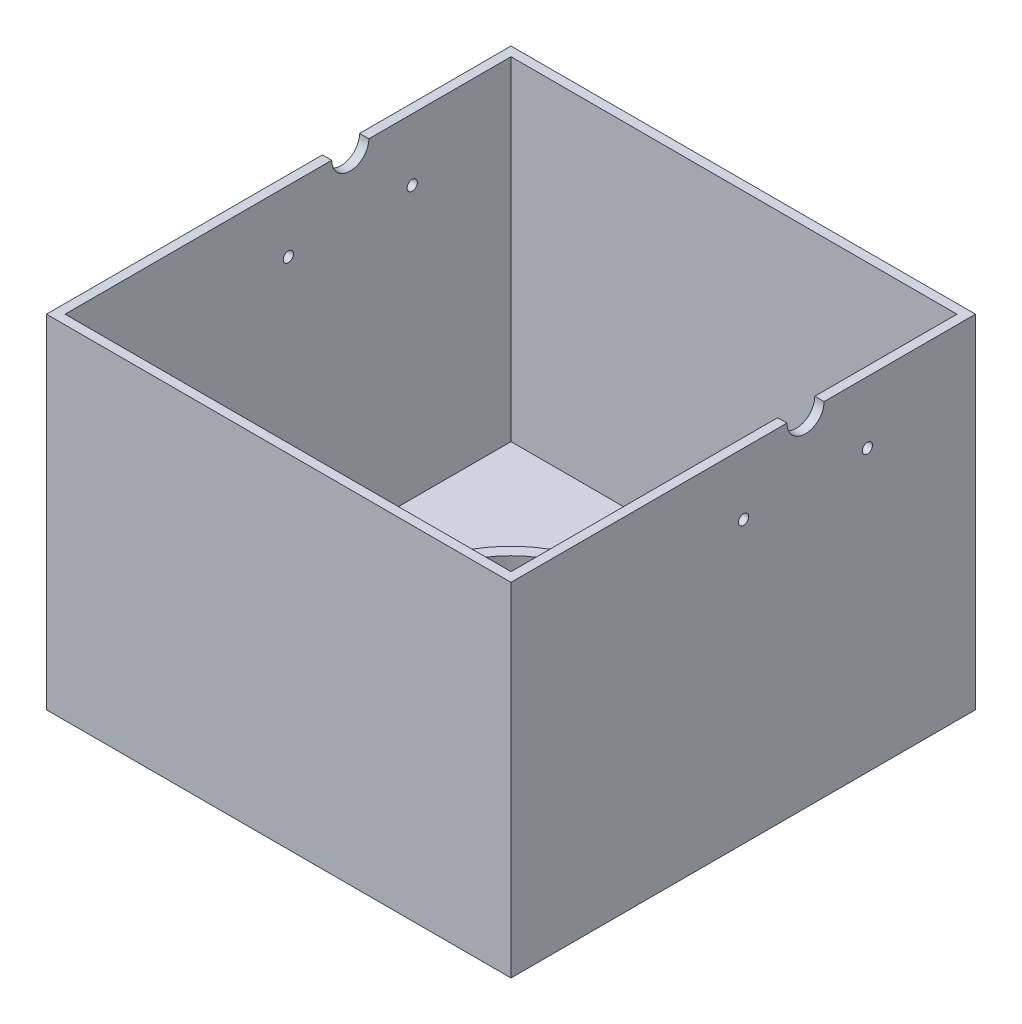
from build123d import *

# Parameters (mm, degrees)
SKETCH_1_W          = 150
SKETCH_1_H          = 150
EXTRUDE_1_DEPTH     = 3
SKETCH_2_W          = 150
SKETCH_2_H          = 150
SKETCH_2_W_2        = 144
SKETCH_2_H_2        = 144
EXTRUDE_2_DEPTH     = 107.65
SKETCH_3_R          = 31.25
CUT_EXTRUDE_1_DEPTH = 91
SKETCH_4_R          = 6
CUT_EXTRUDE_2_DEPTH = 201.9189451
SKETCH_8_R          = 35
SKETCH_8_R_2        = 31.25
EXTRUDE_4_DEPTH     = 18
SKETCH_9_R          = 1.65
CUT_EXTRUDE_3_DEPTH = 201.9189451
SKETCH_11_R         = 31.25
SKETCH_11_R_2       = 27.5
EXTRUDE_5_DEPTH     = 3


with BuildPart() as part:
    # 草图1 → 凸台-拉伸1 (new body)
    with BuildSketch(Plane(origin=(0, 0, 0), x_dir=(1, 0, 0), z_dir=(0, 1, 0))):
        Rectangle(SKETCH_1_W, SKETCH_1_H)
    extrude(amount=EXTRUDE_1_DEPTH)

    # 草图2 → 凸台-拉伸2 (add)
    with BuildSketch(Plane(origin=(0, 3, 0), x_dir=(1, 0, 0), z_dir=(0, 1, 0))):
        Rectangle(SKETCH_2_W, SKETCH_2_H)
        Rectangle(SKETCH_2_W_2, SKETCH_2_H_2, mode=Mode.SUBTRACT)
    extrude(amount=EXTRUDE_2_DEPTH)

    # 草图3 → 切除-拉伸1 (cut)
    with BuildSketch(Plane.XZ):
        Circle(SKETCH_3_R)
    extrude(amount=-CUT_EXTRUDE_1_DEPTH, mode=Mode.SUBTRACT)

    # 草图4 → 切除-拉伸2 (cut, through all)
    with BuildSketch(Plane.ZY.offset(75)):
        with Locations((-20.1, 110.65)):
            Circle(SKETCH_4_R)
    extrude(amount=-CUT_EXTRUDE_2_DEPTH, mode=Mode.SUBTRACT)

    # 草图8 → 凸台-拉伸4 (add, symmetric)
    with BuildSketch(Plane(origin=(0, 3, 0), x_dir=(1, 0, 0), z_dir=(0, 1, 0))):
        Circle(SKETCH_8_R)
        Circle(SKETCH_8_R_2, mode=Mode.SUBTRACT)
    extrude(amount=EXTRUDE_4_DEPTH, both=True)

    # 草图9 → 切除-拉伸3 (cut, through all)
    with BuildSketch(Plane.ZY.offset(75)):
        with Locations((-40.1, 90.65)):
            Circle(SKETCH_9_R)
        with Locations((-0.1, 90.65)):
            Circle(SKETCH_9_R)
    extrude(amount=-CUT_EXTRUDE_3_DEPTH, mode=Mode.SUBTRACT)

    # 草图11 → 凸台-拉伸5 (add)
    with BuildSketch(Plane.XZ.offset(15)):
        Circle(SKETCH_11_R)
        Circle(SKETCH_11_R_2, mode=Mode.SUBTRACT)
    extrude(amount=-EXTRUDE_5_DEPTH)


solid = part.part
